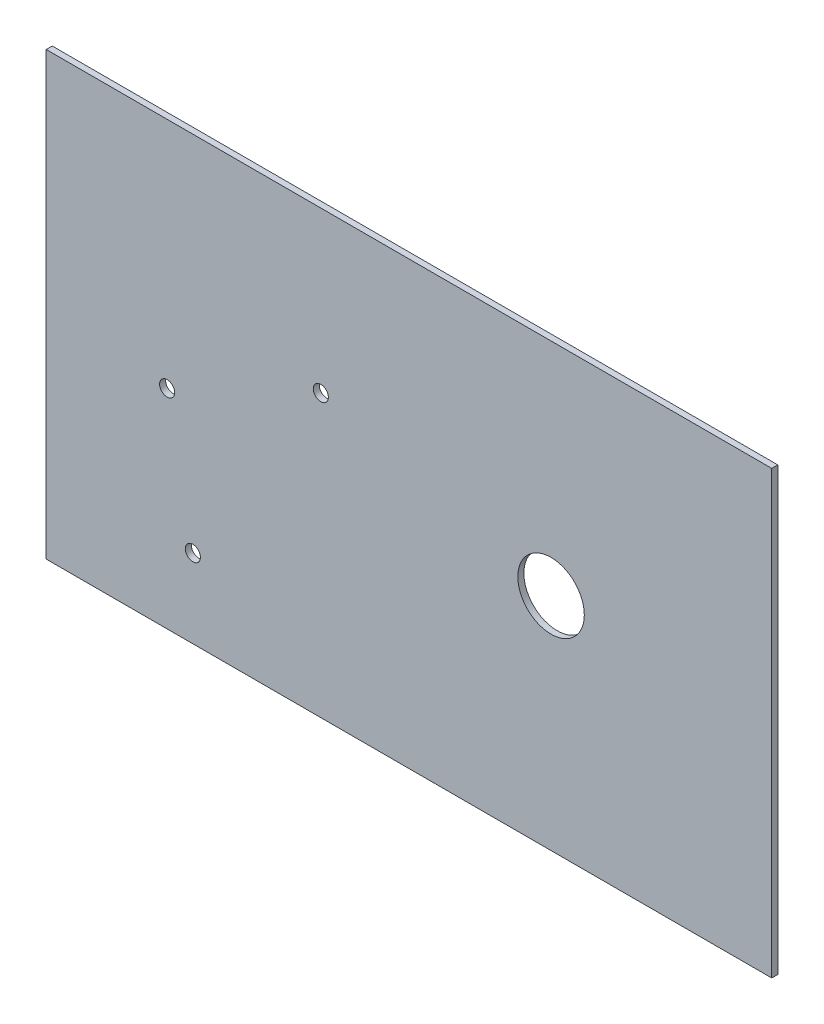
from build123d import *

# Parameters (mm, degrees)
SKETCH_1_W      = 240
SKETCH_1_H      = 146
SKETCH_1_R      = 2.5
SKETCH_1_R_2    = 11
EXTRUDE_1_DEPTH = 2


with BuildPart() as part:
    # Эскиз1 → Бобышка-Вытянуть1 (new body)
    with BuildSketch(Plane.XY):
        with Locations((120, 73)):
            Rectangle(SKETCH_1_W, SKETCH_1_H)
        with Locations((48.515350749, 26)):
            Circle(SKETCH_1_R, mode=Mode.SUBTRACT)
        with Locations((40, 68.913299822)):
            Circle(SKETCH_1_R, mode=Mode.SUBTRACT)
        with Locations((90.832011317, 93)):
            Circle(SKETCH_1_R, mode=Mode.SUBTRACT)
        with Locations((167, 73)):
            Circle(SKETCH_1_R_2, mode=Mode.SUBTRACT)
    extrude(amount=EXTRUDE_1_DEPTH)


solid = part.part
